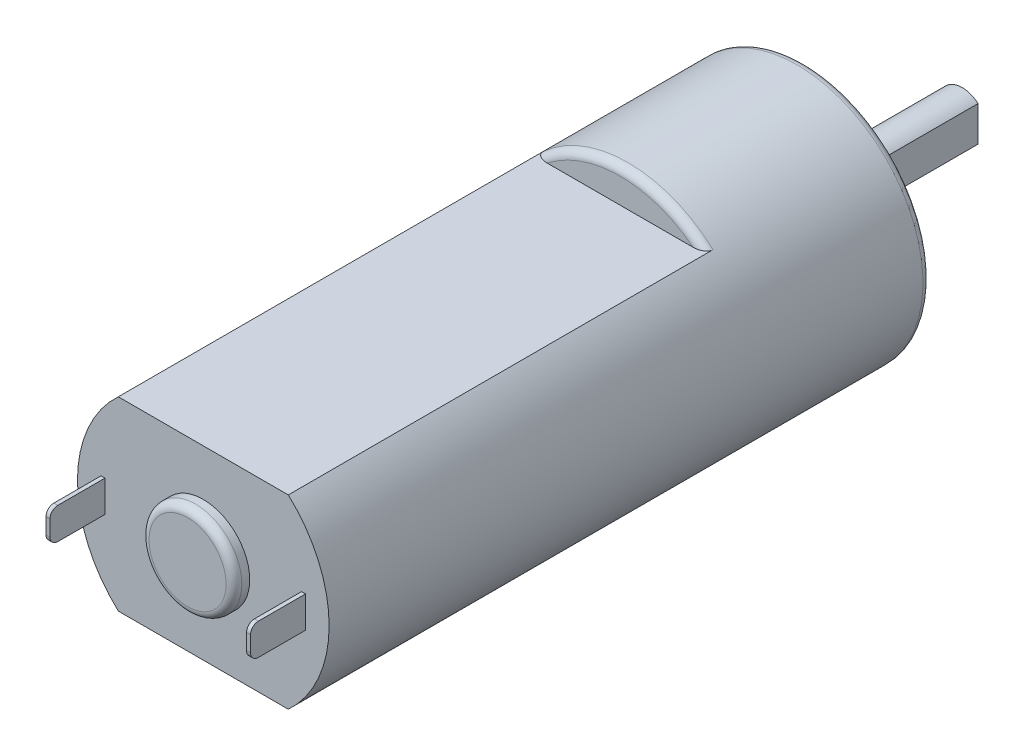
from build123d import *

# Parameters (mm, degrees)
SKETCH1_W           = 8
SKETCH1_H           = 38.25
SKETCH2_R           = 3
BOSS_EXTRUDE1_DEPTH = 2
BOSS_EXTRUDE2_DEPTH = 8
CUT_EXTRUDE1_START  = -2
CUT_EXTRUDE1_DEPTH  = 2
CUT_EXTRUDE2_DEPTH  = 26.5
CUT_EXTRUDE3_DEPTH  = 26.5
SKETCH7_W           = 0.25
SKETCH7_H           = 2
BOSS_EXTRUDE3_DEPTH = 3.5
SKETCH8_W           = 0.25
SKETCH8_H           = 2
BOSS_EXTRUDE4_DEPTH = 3.5
SKETCH9_R           = 2.95
BOSS_EXTRUDE5_DEPTH = 1
FILLET1_R           = 0.5


with BuildPart() as part:
    # Sketch1 → Revolve1 (revolve)
    with BuildSketch(Plane.XZ):
        with Locations((4, 19.125)):
            Rectangle(SKETCH1_W, SKETCH1_H)
    revolve(axis=Axis((0, 0, 38.25), (0, 0, -1)))

    # Sketch2 → Boss-Extrude1 (add)
    with BuildSketch(Plane(origin=(0, 0, 0), x_dir=(-1, 0, 0), z_dir=(0, 0, -1))):
        Circle(SKETCH2_R)
    extrude(amount=BOSS_EXTRUDE1_DEPTH)

    # Sketch3 → Boss-Extrude2 (add)
    with BuildSketch(Plane(origin=(0, 0, -2), x_dir=(-1, 0, 0), z_dir=(0, 0, -1))):
        with BuildLine():
            Line((-1, -1.118033989), (-1, 1.118033989))
            ThreePointArc((-1, 1.118033989), (1.5, 0), (-1, -1.118033989))
        make_face()
    extrude(amount=BOSS_EXTRUDE2_DEPTH)

    # Sketch4 → Cut-Extrude1 (cut)
    with BuildSketch(Plane(origin=(0, 0, -2), x_dir=(-1, 0, 0), z_dir=(0, 0, -1)).offset(CUT_EXTRUDE1_START)):
        with BuildLine():
            Line((-1, -1.118033989), (-1, 1.118033989))
            ThreePointArc((-1, 1.118033989), (-1.5, 0), (-1, -1.118033989))
        make_face()
    extrude(amount=CUT_EXTRUDE1_DEPTH, mode=Mode.SUBTRACT)

    # Sketch5 → Cut-Extrude2 (cut)
    with BuildSketch(Plane.XY.offset(38.25)):
        with BuildLine():
            Line((-5.402777064, 5.9), (5.402777064, 5.9))
            ThreePointArc((5.402777064, 5.9), (0, 8), (-5.402777064, 5.9))
        make_face()
    extrude(amount=-CUT_EXTRUDE2_DEPTH, mode=Mode.SUBTRACT)

    # Sketch6 → Cut-Extrude3 (cut)
    with BuildSketch(Plane.XY.offset(38.25)):
        with BuildLine():
            Line((5.402777064, -5.9), (-5.402777064, -5.9))
            ThreePointArc((-5.402777064, -5.9), (0, -8), (5.402777064, -5.9))
        make_face()
    extrude(amount=-CUT_EXTRUDE3_DEPTH, mode=Mode.SUBTRACT)

    # Sketch7 → Boss-Extrude3 (add)
    with BuildSketch(Plane.XY.offset(38.25)):
        with Locations((-6.375, 0)):
            Rectangle(SKETCH7_W, SKETCH7_H)
    extrude(amount=BOSS_EXTRUDE3_DEPTH)

    # Sketch8 → Boss-Extrude4 (add)
    with BuildSketch(Plane.XY.offset(38.25)):
        with Locations((6.375, 0)):
            Rectangle(SKETCH8_W, SKETCH8_H)
    extrude(amount=BOSS_EXTRUDE4_DEPTH)

    # Sketch9 → Boss-Extrude5 (add)
    with BuildSketch(Plane.XY.offset(38.25)):
        Circle(SKETCH9_R)
    extrude(amount=BOSS_EXTRUDE5_DEPTH)

    # Fillet1
    fillet1_edges = [part.edges().sort_by_distance(p)[0] for p in [
        (-6.375, 1, 41.75),
        (6.375, 1, 41.75),
        (6.375, -1, 41.75),
        (0, -8, 11.75),
        (-6.375, -1, 41.75),
        (0, 8, 11.75),
        (-8, 0, 0),
        (-2.95, 0, 39.25),
    ]]
    fillet(fillet1_edges, radius=FILLET1_R)


solid = part.part
